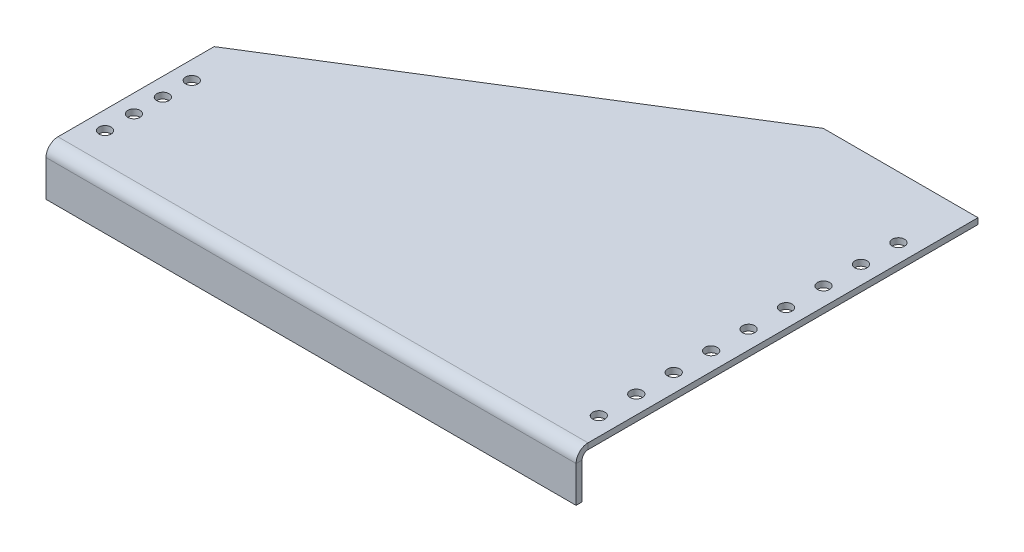
from build123d import *

# Parameters (mm, degrees)
SKETCH1_W                    = 209.476
SKETCH1_H                    = 175.514
BASE_FLANGE1_DEPTH           = 2.3622
EDGE_FLANGE4_STRIP_W         = 14.1688
EDGE_FLANGE4_STRIP_H         = 2.3622
EDGE_FLANGE4_STRIP_CUT_DEPTH = 209.476
EDGE_FLANGE4_DEPTH           = 209.476
CUT_EXTRUDE1_DEPTH           = 152.058528265
SKETCH38_R                   = 2.413
CUT_EXTRUDE2_DEPTH           = 152.058528265
SKETCH39_R                   = 2.413
CUT_EXTRUDE3_DEPTH           = 152.058528265


# Sheet-metal steps are written as plain solids
with BuildPart() as part:
    # Sketch1 → Base-Flange1 (new body)
    with BuildSketch(Plane(origin=(0, 0, 0), x_dir=(1, 0, 0), z_dir=(0, 1, 0))):
        with Locations((15.34, 0)):
            Rectangle(SKETCH1_W, SKETCH1_H)
    extrude(amount=-BASE_FLANGE1_DEPTH)

    # Edge-Flange4 strip (across the edge) → Edge-Flange4 strip cut (cut)
    with BuildSketch(Plane(origin=(120.078, -2.3622, 87.757), x_dir=(0, 0, -1), z_dir=(-1, 0, 0))):
        with Locations((-4.7244, -1.1811)):
            Rectangle(EDGE_FLANGE4_STRIP_W, EDGE_FLANGE4_STRIP_H)
    extrude(amount=EDGE_FLANGE4_STRIP_CUT_DEPTH, mode=Mode.SUBTRACT)

    # Edge-Flange4 section (across the edge) → Edge-Flange4 (add)
    with BuildSketch(Plane(origin=(120.078, -2.3622, 87.757), x_dir=(0, 0, -1), z_dir=(-1, 0, 0))):
        with BuildLine():
            Line((-2.3622, 2.36), (-2.3622, 16.6878))
            Line((-2.3622, 16.6878), (0, 16.6878))
            Line((0, 16.6878), (0, 2.36))
            ThreePointArc((0, 2.36), (0.691227996, 0.691227996), (2.36, 0))
            Line((2.36, 0), (2.36, -2.3622))
            ThreePointArc((2.36, -2.3622), (-0.979099642, -0.979099642), (-2.3622, 2.36))
        make_face()
    extrude(amount=EDGE_FLANGE4_DEPTH)

    # Sketch36 → Cut-Extrude1 (cut, through all)
    with BuildSketch(Plane.XZ.offset(2.3622)):
        Polygon((-94.1202, 26.6192), (58.938, -68.707), (140.022587244, -68.707), (140.022587244, -102.574234495), (-121.93122604, -102.574234495), (-121.93122604, 26.6192), align=None)
    extrude(amount=-CUT_EXTRUDE1_DEPTH, mode=Mode.SUBTRACT)

    # Sketch38 → Cut-Extrude2 (cut, through all)
    with BuildSketch(Plane.XZ.offset(2.3622)):
        with Locations(Location((-82.2341, 73.967, 0), (0, 0, 270))):
            Circle(SKETCH38_R)
        with Locations(Location((-82.2341, 62.537, 0), (0, 0, 270))):
            Circle(SKETCH38_R)
        with Locations(Location((-82.2341, 51.107, 0), (0, 0, 270))):
            Circle(SKETCH38_R)
        with Locations(Location((-82.2341, 39.677, 0), (0, 0, 270))):
            Circle(SKETCH38_R)
    extrude(amount=-CUT_EXTRUDE2_DEPTH, mode=Mode.SUBTRACT)

    # Sketch39 → Cut-Extrude3 (cut, through all)
    with BuildSketch(Plane.XZ.offset(2.3622)):
        with Locations(Location((112.9141, 73.967, 0), (0, 0, 270))):
            Circle(SKETCH39_R)
        with Locations(Location((112.9141, 59.168910638, 0), (0, 0, 270))):
            Circle(SKETCH39_R)
        with Locations(Location((112.9141, 44.370821275, 0), (0, 0, 270))):
            Circle(SKETCH39_R)
        with Locations(Location((112.9141, 29.572731913, 0), (0, 0, 270))):
            Circle(SKETCH39_R)
        with Locations(Location((112.9141, 14.774642551, 0), (0, 0, 270))):
            Circle(SKETCH39_R)
        with Locations(Location((112.9141, -0.023446812, 0), (0, 0, 270))):
            Circle(SKETCH39_R)
        with Locations(Location((112.9141, -14.821536174, 0), (0, 0, 270))):
            Circle(SKETCH39_R)
        with Locations(Location((112.9141, -29.619625536, 0), (0, 0, 270))):
            Circle(SKETCH39_R)
        with Locations(Location((112.9141, -44.417714899, 0), (0, 0, 270))):
            Circle(SKETCH39_R)
    extrude(amount=-CUT_EXTRUDE3_DEPTH, mode=Mode.SUBTRACT)


solid = part.part
